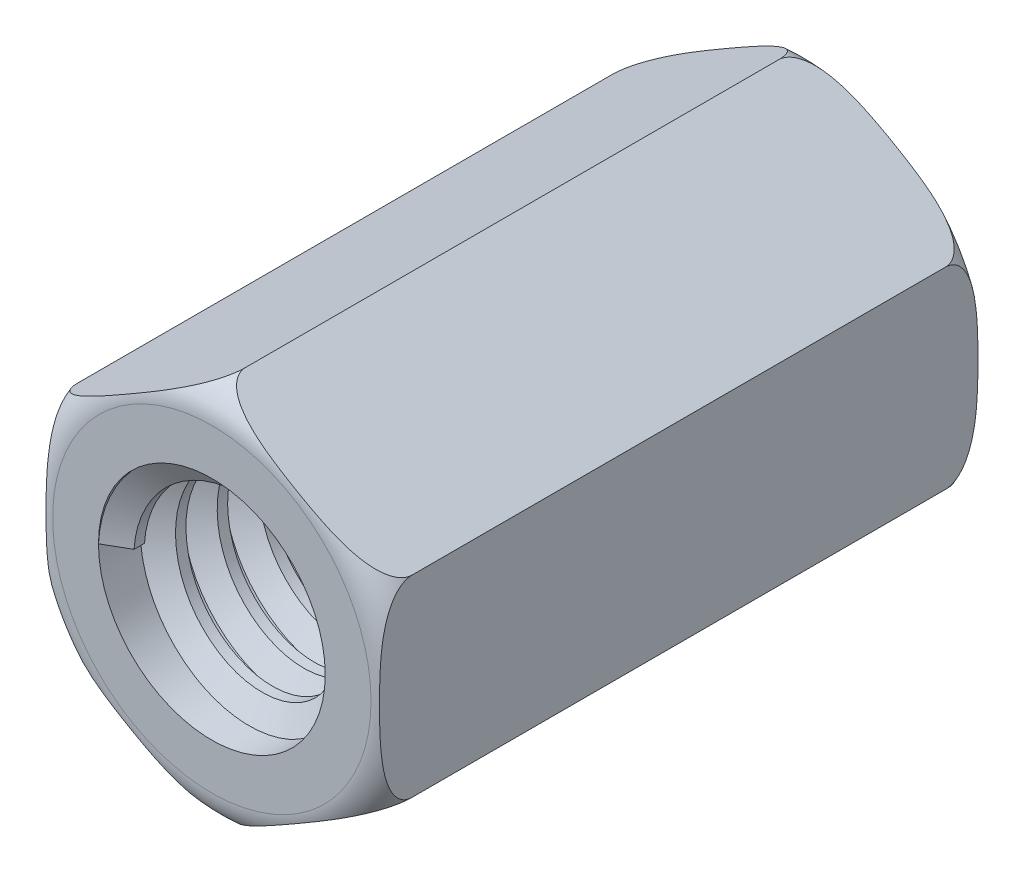
from build123d import *

# Parameters (mm, degrees)
BOSS_EXTRUDE_DEPTH = 9
TAPPED_HOLE_D      = 6.8
THREAD1_PITCH      = 1.25


with BuildPart() as part:
    # Sketch1 → Boss Extrude (new, symmetric)
    with BuildSketch(Plane.XY):
        Polygon((0, 5.773502692), (-5, 2.886751346), (-5, -2.886751346), (0, -5.773502692), (5, -2.886751346), (5, 2.886751346), align=None)
    extrude(amount=BOSS_EXTRUDE_DEPTH, both=True)

    # Sketch3 → Cut-Revolve1 (revolve, cut)
    with BuildSketch(Plane(origin=(0, 0, 0), x_dir=(0, 0, -1), z_dir=(1, 0, 0)), mode=Mode.PRIVATE) as cut_revolve1_sk:
        with BuildLine():
            Line((-8, 5.773502692), (-9, 5.773502692))
            Line((-9, 5.773502692), (-9, 4.773502692))
            ThreePointArc((-9, 4.773502692), (-8.707106781, 5.480609473), (-8, 5.773502692))
        make_face()
        with BuildLine():
            Line((9, 5.773502692), (9, 4.773502692))
            ThreePointArc((9, 4.773502692), (8.707106781, 5.480609473), (8, 5.773502692))
            Line((8, 5.773502692), (9, 5.773502692))
        make_face()
    revolve(cut_revolve1_sk.sketch.rotate(Axis((0, 0, 9), (0, 0, -1)), 90), axis=Axis((0, 0, 9), (0, 0, -1)), mode=Mode.SUBTRACT)

    # Tapped Hole (through all)
    with Locations(Plane.XY.offset(9)):
        with Locations((0, 0)):
            Hole(TAPPED_HOLE_D / 2)

    # Thread1: the profile of Thread Profile2 profile screwed along a right-hand helix of 13.4 turns, 8 arcs to a turn; built about Z, then put on its axis
    thread1_z = Axis((0, 0, 0), (0, 0, 1))
    thread1_corners = [(3.4003, 0, -0.000173205), (3.4003, 0, 1.093923202), (2.723417656, 0, 0.703124998), (2.723417656, 0, 0.390624998)]
    with BuildLine(mode=Mode.PRIVATE) as thread1_profile:
        Line(thread1_corners[0], thread1_corners[1])
        Line(thread1_corners[1], thread1_corners[2])
        Line(thread1_corners[2], thread1_corners[3])
        Line(thread1_corners[3], thread1_corners[0])
    thread1_cap = Face(thread1_profile.wire())
    thread1_turn_angles = [0, 22.5, 45, 67.5, 90, 112.5, 135, 157.5, 180, 202.5, 225, 247.5, 270, 292.5, 315, 337.5, 360]
    thread1_turn_weights = [1, 0.9238795325112867, 1, 0.9238795325112867, 1, 0.9238795325112867, 1, 0.9238795325112867, 1, 0.9238795325112867, 1, 0.9238795325112867, 1, 0.9238795325112867, 1, 0.9238795325112867, 1]
    thread1_turn_rails = [Edge.make_bspline([Vector(p[0], p[1], 0).rotate(thread1_z, thread1_turn_angles[k]) / thread1_turn_weights[k] + Vector(0, 0, p[2] + THREAD1_PITCH * thread1_turn_angles[k] / 360) for k in range(17)], [0, 0, 0, 1, 1, 2, 2, 3, 3, 4, 4, 5, 5, 6, 6, 7, 7, 8, 8, 8], 2, thread1_turn_weights) for p in thread1_corners]
    thread1_turn_sides = [Face.make_surface_from_curves(thread1_turn_rails[p[0]], thread1_turn_rails[p[1]]) for p in [(0, 1), (1, 2), (2, 3), (3, 0)]]
    thread1_last_angles = [4680, 4702.5, 4725, 4747.5, 4770, 4792.5, 4815, 4819.5, 4824]
    thread1_last_weights = [1, 0.9238795325112867, 1, 0.9238795325112867, 1, 0.9238795325112867, 1, 0.996917333733128, 1]
    thread1_last_rails = [Edge.make_bspline([Vector(p[0], p[1], 0).rotate(thread1_z, thread1_last_angles[k]) / thread1_last_weights[k] + Vector(0, 0, p[2] + THREAD1_PITCH * thread1_last_angles[k] / 360) for k in range(9)], [0, 0, 0, 1, 1, 2, 2, 3, 3, 4, 4, 4], 2, thread1_last_weights) for p in thread1_corners]
    thread1_last_sides = [Face.make_surface_from_curves(thread1_last_rails[p[0]], thread1_last_rails[p[1]]) for p in [(0, 1), (1, 2), (2, 3), (3, 0)]]
    thread1 = Plane(origin=(0, 0, 9), x_dir=(-1, 0, 0), z_dir=(0, 0, -1)) * Solid(Shell([*[p.moved(Location((0, 0, THREAD1_PITCH * i))) for i in range(13) for p in thread1_turn_sides], *thread1_last_sides, thread1_cap, thread1_cap.rotate(thread1_z, 4824).moved(Location((0, 0, THREAD1_PITCH * 4824 / 360)))]))
    add(thread1)


solid = part.part
